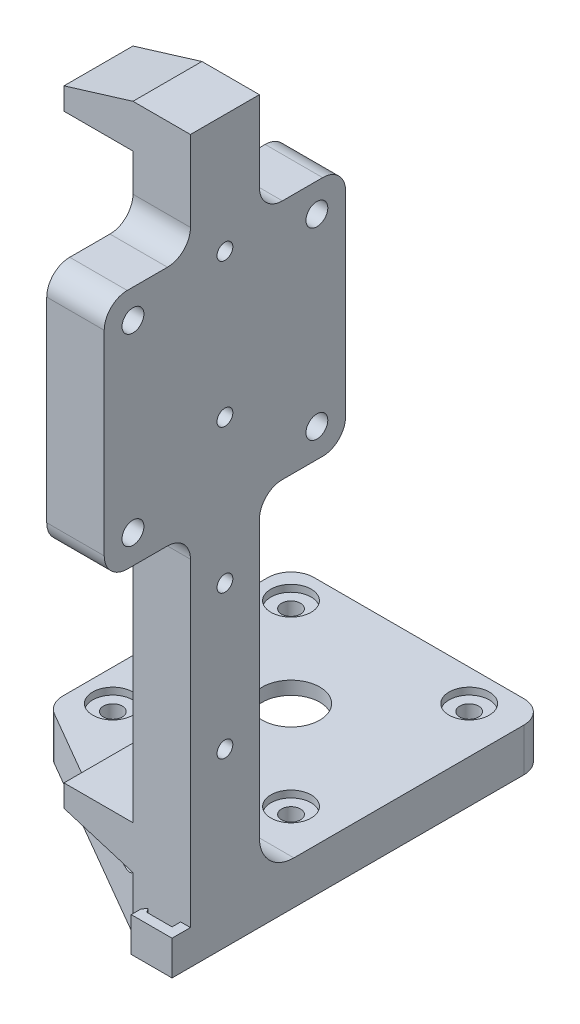
from build123d import *

# Parameters (mm, degrees)
SKETCH1_W           = 42
SKETCH1_H           = 42
SKETCH1_R           = 1.9
BOSS_EXTRUDE1_DEPTH = 10
SKETCH2_W           = 12
SKETCH2_H           = 118
BOSS_EXTRUDE2_DEPTH = 10
SKETCH3_W           = 12
SKETCH3_H           = 3.75
BOSS_EXTRUDE3_DEPTH = 12
CHAMFER1_SIZE       = 3.75
CHAMFER1_SIZE_2     = 12.265697319
SKETCH4_R           = 1.375
CUT_EXTRUDE1_DEPTH  = 12
SKETCH5_W           = 42
SKETCH5_H           = 42
SKETCH5_R           = 1.65
SKETCH5_R_2         = 5
BOSS_EXTRUDE4_DEPTH = 7.5
SKETCH6_R           = 12.5
CUT_EXTRUDE2_DEPTH  = 5.2
FILLET1_R           = 4
FILLET2_R           = 6
SKETCH8_R           = 3.5
CUT_EXTRUDE4_DEPTH  = 1.2
BOSS_EXTRUDE7_DEPTH = 6


with BuildPart() as part:
    # Sketch1 → Boss-Extrude1 (new body)
    with BuildSketch(Plane(origin=(0, 0, 0), x_dir=(0, 0, -1), z_dir=(1, 0, 0))):
        Rectangle(SKETCH1_W, SKETCH1_H)
        with Locations((16, -16)):
            Circle(SKETCH1_R, mode=Mode.SUBTRACT)
        with Locations((-16, -16)):
            Circle(SKETCH1_R, mode=Mode.SUBTRACT)
        with Locations((-16, 16)):
            Circle(SKETCH1_R, mode=Mode.SUBTRACT)
        with Locations((16, 16)):
            Circle(SKETCH1_R, mode=Mode.SUBTRACT)
    extrude(amount=BOSS_EXTRUDE1_DEPTH)

    # Sketch2 → Boss-Extrude2 (add)
    with BuildSketch(Plane.ZY):
        with Locations((0, -20)):
            Rectangle(SKETCH2_W, SKETCH2_H)
    extrude(amount=-BOSS_EXTRUDE2_DEPTH)

    # Sketch3 → Boss-Extrude3 (add)
    with BuildSketch(Plane.ZY):
        with Locations((0, 33.375)):
            Rectangle(SKETCH3_W, SKETCH3_H)
        with Locations((0, -71.575)):
            Rectangle(SKETCH3_W, SKETCH3_H)
    extrude(amount=BOSS_EXTRUDE3_DEPTH)

    # Chamfer1
    # the kernel refuses this chamfer: 12.265697319, 3.75 mm, written as the material it adds along each edge
    with BuildSketch(Plane(origin=(0, 35.25, -6), x_dir=(0.11964200288050787, 0.9928170985366542, 0), z_dir=(0, 0, 1))) as chamfer1_piece_1_section:
        Polygon((CHAMFER1_SIZE * 0.992817098537, CHAMFER1_SIZE * 0.119642002881), (-CHAMFER1_SIZE_2 * 0.119642002884, CHAMFER1_SIZE_2 * 0.992817098562), (0, 0), align=None)
    chamfer1_piece_1 = extrude(amount=12, mode=Mode.PRIVATE)
    chamfer1_piece_1 = split(chamfer1_piece_1, bisect_by=Plane(origin=(-4.172539525, 39, 0), z_dir=(0, -1, 0)), keep=Keep.TOP, mode=Mode.PRIVATE)
    chamfer1_piece_1 = split(chamfer1_piece_1, bisect_by=Plane(origin=(-12, 36.383581674, 0), z_dir=(1, 0, 0)), keep=Keep.TOP, mode=Mode.PRIVATE)
    add(chamfer1_piece_1)
    with BuildSketch(Plane(origin=(0, -73.45, -6), x_dir=(0.11964200288050787, -0.9928170985366542, 0), z_dir=(0, 0, 1))) as chamfer1_piece_2_section:
        Polygon((CHAMFER1_SIZE * 0.992817098537, -CHAMFER1_SIZE * 0.119642002881), (-CHAMFER1_SIZE_2 * 0.119642002884, -CHAMFER1_SIZE_2 * 0.992817098562), (0, 0), align=None)
    chamfer1_piece_2 = extrude(amount=12, mode=Mode.PRIVATE)
    chamfer1_piece_2 = split(chamfer1_piece_2, bisect_by=Plane(origin=(-12, -74.58994207, 0), z_dir=(1, 0, 0)), keep=Keep.TOP, mode=Mode.PRIVATE)
    add(chamfer1_piece_2)

    # Sketch4 → Cut-Extrude1 (cut)
    with BuildSketch(Plane.ZY):
        with Locations((0, 18.4)):
            Circle(SKETCH4_R)
        with Locations((0, -6.6)):
            Circle(SKETCH4_R)
        with Locations((0, -31.6)):
            Circle(SKETCH4_R)
        with Locations((0, -56.6)):
            Circle(SKETCH4_R)
    extrude(amount=-CUT_EXTRUDE1_DEPTH, mode=Mode.SUBTRACT)

    # Sketch5 → Boss-Extrude4 (add)
    # profile 1 of 2: a face of its own
    with BuildSketch(Plane.XZ.offset(79)):
        Polygon((10, -56), (10, 6), (0, 6), (-34.5, -14), (7.5, -14), (7.5, -56), align=None)
    # profile 2 of 2: a face of its own
    with BuildSketch(Plane.XZ.offset(79)):
        with Locations((-13.5, -35)):
            Rectangle(SKETCH5_W, SKETCH5_H)
        with Locations(Location((-29, -50.5, 0), (0, 0, 270))):
            Circle(SKETCH5_R, mode=Mode.SUBTRACT)
        with Locations(Location((-13.5, -35, 0), (0, 0, 270))):
            Circle(SKETCH5_R_2, mode=Mode.SUBTRACT)
        with Locations(Location((2, -50.5, 0), (0, 0, 270))):
            Circle(SKETCH5_R, mode=Mode.SUBTRACT)
        with Locations(Location((-29, -19.5, 0), (0, 0, 270))):
            Circle(SKETCH5_R, mode=Mode.SUBTRACT)
        with Locations(Location((2, -19.5, 0), (0, 0, 270))):
            Circle(SKETCH5_R, mode=Mode.SUBTRACT)
    extrude(amount=BOSS_EXTRUDE4_DEPTH)

    # Sketch6 → Cut-Extrude2 (cut)
    with BuildSketch(Plane.XZ.offset(86.5)):
        with Locations(Location((-13.5, -35, 0), (0, 0, 270))):
            Circle(SKETCH6_R)
    extrude(amount=-CUT_EXTRUDE2_DEPTH, mode=Mode.SUBTRACT)

    # Fillet1
    fillet1_edges = [part.edges().sort_by_distance(p)[0] for p in [
        (-34.5, -82.75, -56),
        (10, -82.75, -56),
        (-34.5, -82.75, -14),
        (5, -21, 6),
        (5, -21, -6),
        (5, 21, -6),
        (5, 21, 6),
        (5, -21, -21),
        (5, -21, 21),
        (5, 21, 21),
        (5, 21, -21),
    ]]
    fillet(fillet1_edges, radius=FILLET1_R)

    # Fillet2
    # the kernel refuses this fillet: 6 mm, written as the material it adds along each edge
    with BuildSketch(Plane(origin=(0, -79, -6), x_dir=(0, 1, 0), z_dir=(1, 0, 0))) as fillet2_piece_1_section:
        with BuildLine():
            CenterArc((FILLET2_R, -FILLET2_R), FILLET2_R, 90, 90)
            Line((0, -FILLET2_R), (-FILLET2_R * 0.02, -FILLET2_R))
            Line((-FILLET2_R * 0.02, -FILLET2_R), (-FILLET2_R * 0.02, FILLET2_R * 0.02))
            Line((-FILLET2_R * 0.02, FILLET2_R * 0.02), (FILLET2_R, FILLET2_R * 0.02))
            Line((FILLET2_R, FILLET2_R * 0.02), (FILLET2_R, 0))
        make_face()
    fillet2_piece_1 = extrude(amount=10, mode=Mode.PRIVATE)
    fillet2_piece_1 = split(fillet2_piece_1, bisect_by=Plane(origin=(2.499298027, -77.964112089, -8.062690797), z_dir=(-0.29237170472287155, -0.9563047559629945, 0)), keep=Keep.TOP, mode=Mode.PRIVATE)
    add(fillet2_piece_1)
    with BuildSketch(Plane(origin=(-15, -79, -6), x_dir=(0, 1, 0), z_dir=(1, 0, 0))) as fillet2_piece_2_section:
        with BuildLine():
            CenterArc((FILLET2_R, -FILLET2_R), FILLET2_R, 90, 90)
            Line((0, -FILLET2_R), (-FILLET2_R * 0.02, -FILLET2_R))
            Line((-FILLET2_R * 0.02, -FILLET2_R), (-FILLET2_R * 0.02, FILLET2_R * 0.02))
            Line((-FILLET2_R * 0.02, FILLET2_R * 0.02), (FILLET2_R, FILLET2_R * 0.02))
            Line((FILLET2_R, FILLET2_R * 0.02), (FILLET2_R, 0))
        make_face()
    fillet2_piece_2 = extrude(amount=25, mode=Mode.PRIVATE)
    fillet2_piece_2 = split(fillet2_piece_2, bisect_by=Plane(origin=(-12, -75.195203729, -6.203668613), z_dir=(1, 0, 0)), keep=Keep.TOP, mode=Mode.PRIVATE)
    fillet2_piece_2 = split(fillet2_piece_2, bisect_by=Plane(origin=(-3.530108064, -76.120737656, -6.203668613), z_dir=(0.29237170472287155, 0.9563047559629945, 0)), keep=Keep.TOP, mode=Mode.PRIVATE)
    fillet2_piece_2 = split(fillet2_piece_2, bisect_by=Plane(origin=(0, -75.195203729, -6.203668613), z_dir=(-1, 0, 0)), keep=Keep.TOP, mode=Mode.PRIVATE)
    add(fillet2_piece_2)
    with BuildSketch(Plane(origin=(0, -79, -6), x_dir=(0, 1, 0), z_dir=(1, 0, 0))) as fillet2_piece_3_section:
        with BuildLine():
            CenterArc((FILLET2_R, -FILLET2_R), FILLET2_R, 90, 90)
            Line((0, -FILLET2_R), (-FILLET2_R * 0.02, -FILLET2_R))
            Line((-FILLET2_R * 0.02, -FILLET2_R), (-FILLET2_R * 0.02, FILLET2_R * 0.02))
            Line((-FILLET2_R * 0.02, FILLET2_R * 0.02), (FILLET2_R, FILLET2_R * 0.02))
            Line((FILLET2_R, FILLET2_R * 0.02), (FILLET2_R, 0))
        make_face()
    fillet2_piece_3 = extrude(amount=10, mode=Mode.PRIVATE)
    fillet2_piece_3 = split(fillet2_piece_3, bisect_by=Plane(origin=(5.482207423, -78.876079011, -7.106323333), z_dir=(0.29237170472287155, 0.9563047559629945, 0)), keep=Keep.TOP, mode=Mode.PRIVATE)
    add(fillet2_piece_3)
    with BuildSketch(Plane(origin=(0, -79, -6), x_dir=(-1, 0, 0), z_dir=(0, 0, 1))) as fillet2_piece_4_section:
        with BuildLine():
            CenterArc((4.284857057, -6), FILLET2_R, 90, 45.572995999)
            Line((0, -1.8), (-0.085697141, -1.716))
            ThreePointArc((-0.085697141, -1.716), (-0.12, -0.9), (-0.12, 0))
            Line((-0.12, 0), (0, 0.12))
            Line((0, 0.12), (4.284857057, 0.12))
            Line((4.284857057, 0.12), (4.284857057, 0))
        make_face()
    fillet2_piece_4 = extrude(amount=12, mode=Mode.PRIVATE)
    fillet2_piece_4 = split(fillet2_piece_4, bisect_by=Plane(origin=(-3.559533533, -78.541465105, 3.936502299), z_dir=(0.5015304356318926, 0, -0.8651400014650138)), keep=Keep.TOP, mode=Mode.PRIVATE)
    add(fillet2_piece_4)
    with BuildSketch(Plane(origin=(-15, -79, -6), x_dir=(0, 1, 0), z_dir=(1, 0, 0))) as fillet2_piece_5a_section:
        with BuildLine():
            CenterArc((FILLET2_R, -FILLET2_R), FILLET2_R, 90, 90)
            Line((0, -FILLET2_R), (-FILLET2_R * 0.02, -FILLET2_R))
            Line((-FILLET2_R * 0.02, -FILLET2_R), (-FILLET2_R * 0.02, FILLET2_R * 0.02))
            Line((-FILLET2_R * 0.02, FILLET2_R * 0.02), (FILLET2_R, FILLET2_R * 0.02))
            Line((FILLET2_R, FILLET2_R * 0.02), (FILLET2_R, 0))
        make_face()
    fillet2_piece_5a = extrude(amount=25, mode=Mode.PRIVATE)
    fillet2_piece_5a = split(fillet2_piece_5a, bisect_by=Plane(origin=(-12, -77.909616739, -7.484859566), z_dir=(1, 0, 0)), keep=Keep.TOP, mode=Mode.PRIVATE)
    fillet2_piece_5a = split(fillet2_piece_5a, bisect_by=Plane(origin=(-5.56448371, -75.498766603, -7.484859566), z_dir=(-0.29237170472287155, -0.9563047559629945, 0)), keep=Keep.TOP, mode=Mode.PRIVATE)
    fillet2_piece_5a = split(fillet2_piece_5a, bisect_by=Plane(origin=(0, -77.909616739, -7.484859566), z_dir=(-1, 0, 0)), keep=Keep.TOP, mode=Mode.PRIVATE)
    with BuildSketch(Plane(origin=(0, -79, -16.712142643), x_dir=(-1, 0, 0), z_dir=(0, 0, 1))) as fillet2_piece_5b_section:
        with BuildLine():
            CenterArc((4.284857057, -6), FILLET2_R, 90, 45.572995999)
            Line((0, -1.8), (-0.085697141, -1.716))
            ThreePointArc((-0.085697141, -1.716), (-0.12, -0.9), (-0.12, 0))
            Line((-0.12, 0), (0, 0.12))
            Line((0, 0.12), (4.284857057, 0.12))
            Line((4.284857057, 0.12), (4.284857057, 0))
        make_face()
    fillet2_piece_5b = extrude(amount=22.712142643, mode=Mode.PRIVATE)
    fillet2_piece_5b = split(fillet2_piece_5b, bisect_by=Plane(origin=(-1.145977821, -78.554932171, -6), z_dir=(0, 0, -1)), keep=Keep.TOP, mode=Mode.PRIVATE)
    fillet2_piece_5 = fillet2_piece_5a & fillet2_piece_5b
    add(fillet2_piece_5)

    # Sketch8 → Cut-Extrude4 (cut)
    with BuildSketch(Plane(origin=(0, -79, 0), x_dir=(1, 0, 0), z_dir=(0, 1, 0))):
        with Locations(Location((-29, 50.5, 0), (0, 0, 270))):
            Circle(SKETCH8_R)
        with Locations(Location((2, 50.5, 0), (0, 0, 270))):
            Circle(SKETCH8_R)
        with Locations(Location((2, 19.5, 0), (0, 0, 270))):
            Circle(SKETCH8_R)
        with Locations(Location((-29, 19.5, 0), (0, 0, 270))):
            Circle(SKETCH8_R)
    extrude(amount=-CUT_EXTRUDE4_DEPTH, mode=Mode.SUBTRACT)

    # Sketch11 → Boss-Extrude7 (add)
    with BuildSketch(Plane.XZ.offset(86.5)):
        Polygon((8.3, 6), (10, 6), (10, 9.2), (2.9, 9.2), (2.9, 7.5), (3.9, 7.5), (8.3, 7.5), align=None)
        Polygon((3.9, 7.5), (2.9, 7.5), (3.433368825, 6.8), align=None)
    extrude(amount=-BOSS_EXTRUDE7_DEPTH)


solid = part.part
